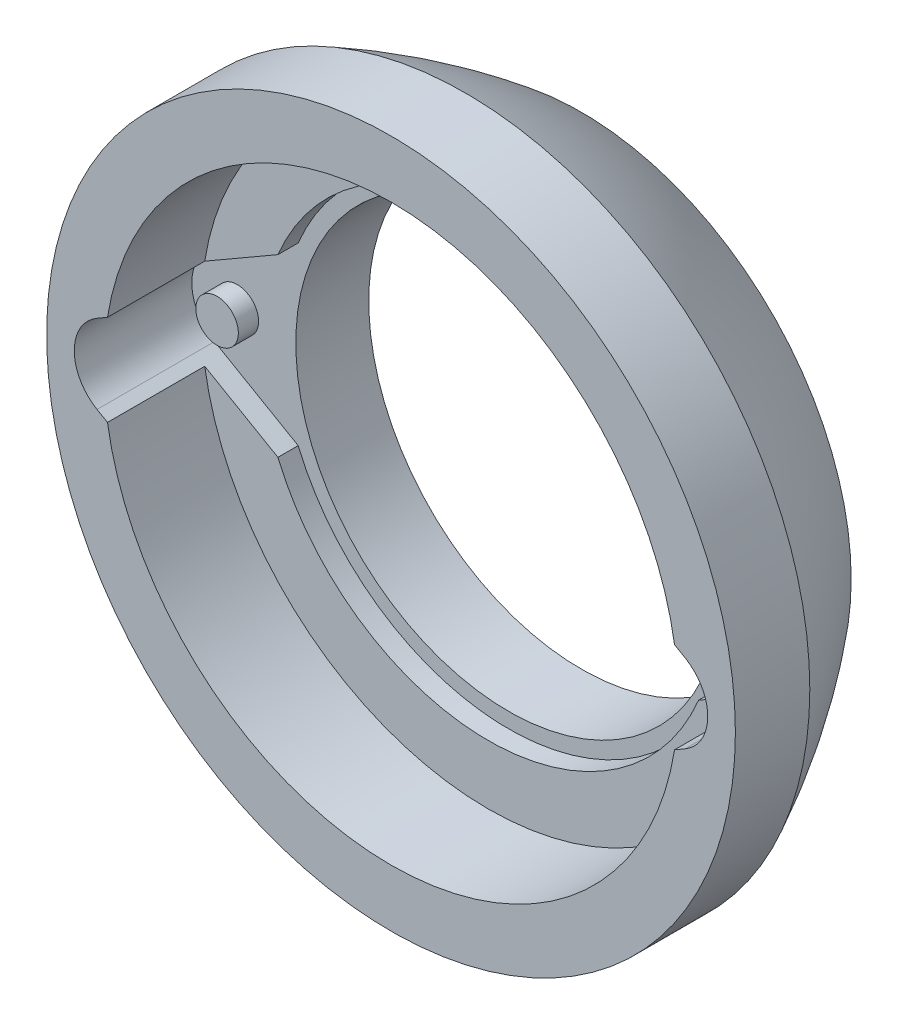
from build123d import *

# Parameters (mm, degrees)
SKETCH58_R                      = 36.0045
CUT_EXTRUDE8_DEPTH              = 12.192
SKETCH59_R                      = 28.575
CUT_EXTRUDE9_DEPTH              = 2.54
SKETCH63_R                      = 2.667
CUT_EXTRUDE11_DEPTH             = 2.54
CUT_EXTRUDE17_REACH             = 64.271
SKETCH63_7_R                    = 2.667
CUT_EXTRUDE17_DIRECTION_2_DEPTH = 2.54
CUT_EXTRUDE18_REACH             = 64.271
SKETCH63_8_R                    = 2.667


with BuildPart() as part:
    # Sketch2 → Revolve2 (revolve)
    with BuildSketch(Plane(origin=(0, 0, 0), x_dir=(0, 0, -1), z_dir=(1, 0, 0))):
        with BuildLine():
            Line((27.12877388, 26.67), (51.00477388, 26.67))
            Line((51.00477388, 26.67), (51.00477388, 33.820685679))
            ThreePointArc((51.00477388, 33.820685679), (43.981751997, 38.88835103), (36.459397472, 43.18))
            Line((36.459397472, 43.18), (27.12877388, 43.18))
            Line((27.12877388, 43.18), (27.12877388, 26.67))
        make_face()
    revolve(axis=Axis((0, 0, 53.897463865), (0, 0, -1)))

    # Sketch58 → Cut-Extrude8 (cut)
    with BuildSketch(Plane.XY.offset(-27.12877388)):
        Circle(SKETCH58_R)
    extrude(amount=-CUT_EXTRUDE8_DEPTH, mode=Mode.SUBTRACT)

    # Sketch59 → Cut-Extrude9 (cut)
    with BuildSketch(Plane.XY.offset(-39.32077388)):
        Circle(SKETCH59_R)
    extrude(amount=-CUT_EXTRUDE9_DEPTH, mode=Mode.SUBTRACT)

    # Sketch63 → Cut-Extrude11 (cut)
    with BuildSketch(Plane.XY.offset(-39.32077388)):
        with BuildLine():
            Line((-36.8575, 4.949335183), (-26.371478487, 11.003442526))
            ThreePointArc((-26.371478487, 11.003442526), (-28.575, 0), (-26.371478487, -11.003442526))
            Line((-26.371478487, -11.003442526), (-36.8575, -4.949335183))
            ThreePointArc((-36.8575, -4.949335183), (-39.715, 0), (-36.8575, 4.949335183))
        make_face()
        with Locations((-34, 0)):
            Circle(SKETCH63_R, mode=Mode.SUBTRACT)
    cut_extrude11 = extrude(amount=-CUT_EXTRUDE11_DEPTH, mode=Mode.SUBTRACT)

    # Sketch63<7> → Cut-Extrude17 (cut, up to next)
    with BuildSketch(Plane.XY.offset(-39.32077388), mode=Mode.PRIVATE) as cut_extrude17_sk1:
        with BuildLine():
            Line((-36.8575, 4.949335183), (-26.371478487, 11.003442526))
            ThreePointArc((-26.371478487, 11.003442526), (-28.575, 0), (-26.371478487, -11.003442526))
            Line((-26.371478487, -11.003442526), (-36.8575, -4.949335183))
            ThreePointArc((-36.8575, -4.949335183), (-39.715, 0), (-36.8575, 4.949335183))
        make_face()
        with Locations((-34, 0)):
            Circle(SKETCH63_7_R, mode=Mode.SUBTRACT)
    cut_extrude17_tool1 = extrude(cut_extrude17_sk1.sketch, amount=CUT_EXTRUDE17_REACH, mode=Mode.PRIVATE) & part.part
    cut_extrude17 = cut_extrude17_tool1.solids().sort_by_distance((-31.485808, -7.753507, -39.320774))[0]
    add(cut_extrude17, mode=Mode.SUBTRACT)

    # Sketch63<7> → Cut-Extrude17 direction 2 (cut)
    with BuildSketch(Plane.XY.offset(-39.32077388)):
        with BuildLine():
            Line((-36.8575, 4.949335183), (-26.371478487, 11.003442526))
            ThreePointArc((-26.371478487, 11.003442526), (-28.575, 0), (-26.371478487, -11.003442526))
            Line((-26.371478487, -11.003442526), (-36.8575, -4.949335183))
            ThreePointArc((-36.8575, -4.949335183), (-39.715, 0), (-36.8575, 4.949335183))
        make_face()
        with Locations((-34, 0)):
            Circle(SKETCH63_7_R, mode=Mode.SUBTRACT)
    cut_extrude17_direction_2 = extrude(amount=-CUT_EXTRUDE17_DIRECTION_2_DEPTH, mode=Mode.SUBTRACT)

    # Sketch63<8> → Cut-Extrude18 (cut, up to next)
    with BuildSketch(Plane.XY.offset(-39.32077388), mode=Mode.PRIVATE) as cut_extrude18_sk1:
        with Locations((-34, 0)):
            Circle(SKETCH63_8_R)
    cut_extrude18_tool1 = extrude(cut_extrude18_sk1.sketch, amount=CUT_EXTRUDE18_REACH, mode=Mode.PRIVATE) & part.part
    cut_extrude18 = cut_extrude18_tool1.solids().sort_by_distance((-34, 0, -39.320774))[0]
    add(cut_extrude18, mode=Mode.SUBTRACT)

    # Mirror2: Cut-Extrude11, Cut-Extrude17, Cut-Extrude17 direction 2, Cut-Extrude18 across plane
    add(cut_extrude11.mirror(Plane(origin=(0, 0, 0), x_dir=(0, 0, 1), z_dir=(1, 0, 0))), mode=Mode.SUBTRACT)
    add(cut_extrude17.mirror(Plane(origin=(0, 0, 0), x_dir=(0, 0, 1), z_dir=(1, 0, 0))), mode=Mode.SUBTRACT)
    add(cut_extrude17_direction_2.mirror(Plane(origin=(0, 0, 0), x_dir=(0, 0, 1), z_dir=(1, 0, 0))), mode=Mode.SUBTRACT)
    add(cut_extrude18.mirror(Plane(origin=(0, 0, 0), x_dir=(0, 0, 1), z_dir=(1, 0, 0))), mode=Mode.SUBTRACT)


solid = part.part
